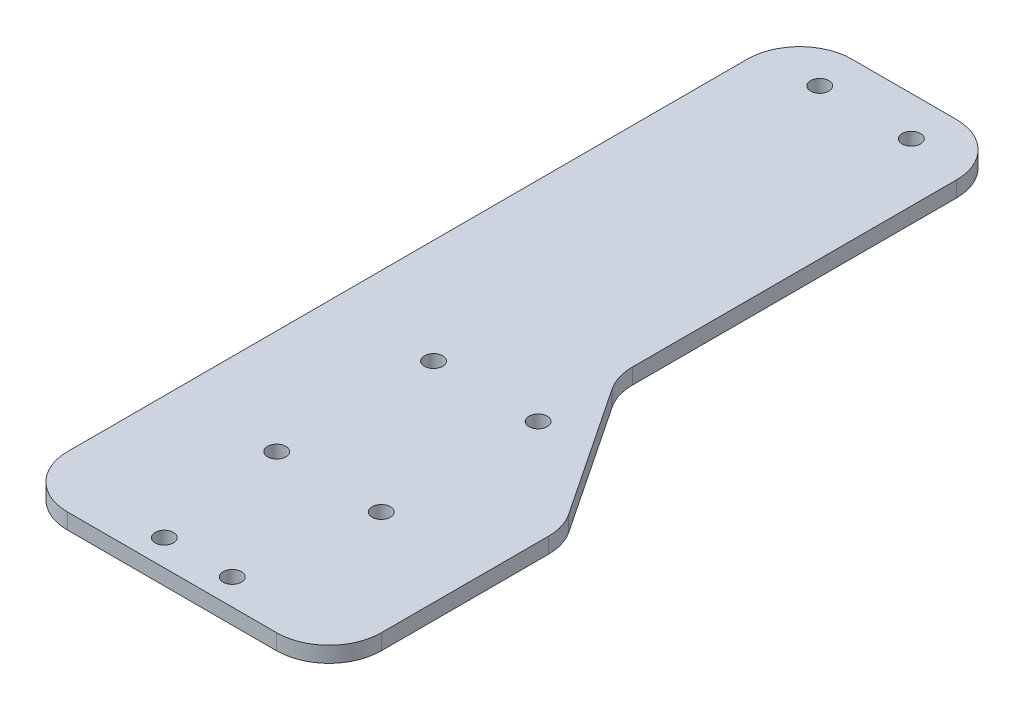
from build123d import *

# Parameters (mm, degrees)
EXTRUDE_1_DEPTH     = 3
SKETCH_3_R          = 1.75
CUT_EXTRUDE_1_DEPTH = 10


with BuildPart() as part:
    # 草图1 → 凸台-拉伸1 (new body)
    with BuildSketch(Plane(origin=(0, 0, 0), x_dir=(1, 0, 0), z_dir=(0, 1, 0))):
        with BuildLine():
            Line((32.5794098, -69.042312481), (32.5794098, -37.070068858))
            ThreePointArc((32.5794098, -37.070068858), (32.150330065, -34.172227371), (30.899912743, -31.523066896))
            Line((30.899912743, -31.523066896), (14.258906856, -6.561558066))
            ThreePointArc((14.258906856, -6.561558066), (13.008489535, -3.91239759), (12.5794098, -1.014556103))
            Line((12.5794098, -1.014556103), (12.5794098, 60.957687519))
            ThreePointArc((12.5794098, 60.957687519), (9.650477612, 68.028755331), (2.5794098, 70.957687519))
            Line((2.5794098, 70.957687519), (-17.4205902, 70.957687519))
            ThreePointArc((-17.4205902, 70.957687519), (-24.491658012, 68.028755331), (-27.4205902, 60.957687519))
            Line((-27.4205902, 60.957687519), (-27.4205902, -69.042312481))
            ThreePointArc((-27.4205902, -69.042312481), (-24.491658012, -76.113380293), (-17.4205902, -79.042312481))
            Line((-17.4205902, -79.042312481), (22.5794098, -79.042312481))
            ThreePointArc((22.5794098, -79.042312481), (29.650477612, -76.113380293), (32.5794098, -69.042312481))
        make_face()
    extrude(amount=EXTRUDE_1_DEPTH)

    # 草图3 → 切除-拉伸1 (cut)
    with BuildSketch(Plane.XZ):
        with Locations((-7.4205902, 49.042312481)):
            Circle(SKETCH_3_R)
        with Locations((-7.4205902, 19.042312481)):
            Circle(SKETCH_3_R)
        with Locations((12.5794098, 19.042312481)):
            Circle(SKETCH_3_R)
        with Locations((12.5794098, 49.042312481)):
            Circle(SKETCH_3_R)
        with Locations((-3.9205902, 74.042312481)):
            Circle(SKETCH_3_R)
        with Locations((9.0794098, 74.042312481)):
            Circle(SKETCH_3_R)
        with Locations((-16.067987387, -63.457687519)):
            Circle(SKETCH_3_R)
        with Locations((1.446740788, -63.457687519)):
            Circle(SKETCH_3_R)
    extrude(amount=-CUT_EXTRUDE_1_DEPTH, mode=Mode.SUBTRACT)


solid = part.part
